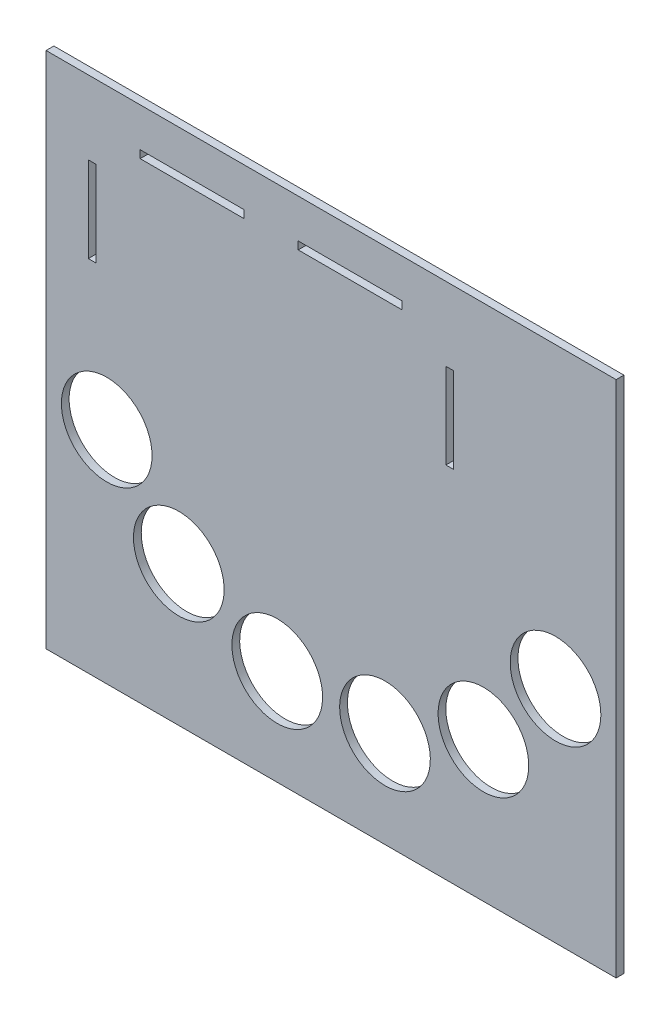
from build123d import *

# Parameters (mm, degrees)
ESQUISSE1_W                  = 220
ESQUISSE1_H                  = 200
BOSS_EXTRU_1_DEPTH           = 3
ESQUISSE2_R                  = 17.5
ENL_V_MAT_EXTRU_1_DEPTH      = 149.690954668
R_P_TITION_CIRCULAIRE1_COUNT = 6
R_P_TITION_CIRCULAIRE1_ANGLE = 120
EMPREINTE1_START             = 82
EMPREINTE1_OUTLINE_W         = 40
EMPREINTE1_OUTLINE_H         = 3
EMPREINTE1_DEPTH             = 3
EMPREINTE1_START_2           = 38.6
EMPREINTE1_2_OUTLINE_W       = 3
EMPREINTE1_2_OUTLINE_H       = 3
EMPREINTE1_2_DEPTH           = 33


# Read off the part's stored shape, not the designer's step: Empreinte1
with BuildPart() as part:
    # Esquisse1 → Boss.-Extru.1 (new body)
    with BuildSketch(Plane.XY):
        Rectangle(ESQUISSE1_W, ESQUISSE1_H)
    extrude(amount=BOSS_EXTRU_1_DEPTH)

    # Esquisse2 → Enlèv. mat.-Extru.1 (cut, through all)
    with BuildSketch(Plane.XY.offset(3)):
        with Locations((-86.602540378, -15)):
            Circle(ESQUISSE2_R)
    enl_v_mat_extru_1 = extrude(amount=-ENL_V_MAT_EXTRU_1_DEPTH, mode=Mode.SUBTRACT)

    # Répétition circulaire1: Enlèv. mat.-Extru.1 ×6 about axis
    r_p_tition_circulaire1_axis = Axis((0, 35, 0), (0, 0, 1))
    for i in range(1, R_P_TITION_CIRCULAIRE1_COUNT):
        add(enl_v_mat_extru_1.rotate(r_p_tition_circulaire1_axis, i * R_P_TITION_CIRCULAIRE1_ANGLE / (R_P_TITION_CIRCULAIRE1_COUNT - 1)), mode=Mode.SUBTRACT)

    # Empreinte1 outline → Empreinte1 (cut)
    with BuildSketch(Plane(origin=(0, 0, 0), x_dir=(1, 0, 0), z_dir=(0, 1, 0)).offset(EMPREINTE1_START)):
        with Locations((-53.7, -1.5)):
            Rectangle(EMPREINTE1_OUTLINE_W, EMPREINTE1_OUTLINE_H)
        with Locations((7.3, -1.5)):
            Rectangle(EMPREINTE1_OUTLINE_W, EMPREINTE1_OUTLINE_H)
    extrude(amount=EMPREINTE1_DEPTH, mode=Mode.SUBTRACT)

    # Empreinte1 2 outline → Empreinte1 2 (cut)
    with BuildSketch(Plane(origin=(0, 0, 0), x_dir=(1, 0, 0), z_dir=(0, 1, 0)).offset(EMPREINTE1_START_2)):
        with Locations((-92.2, -1.5)):
            Rectangle(EMPREINTE1_2_OUTLINE_W, EMPREINTE1_2_OUTLINE_H)
        with Locations((45.8, -1.5)):
            Rectangle(EMPREINTE1_2_OUTLINE_W, EMPREINTE1_2_OUTLINE_H)
    extrude(amount=EMPREINTE1_2_DEPTH, mode=Mode.SUBTRACT)


solid = part.part
